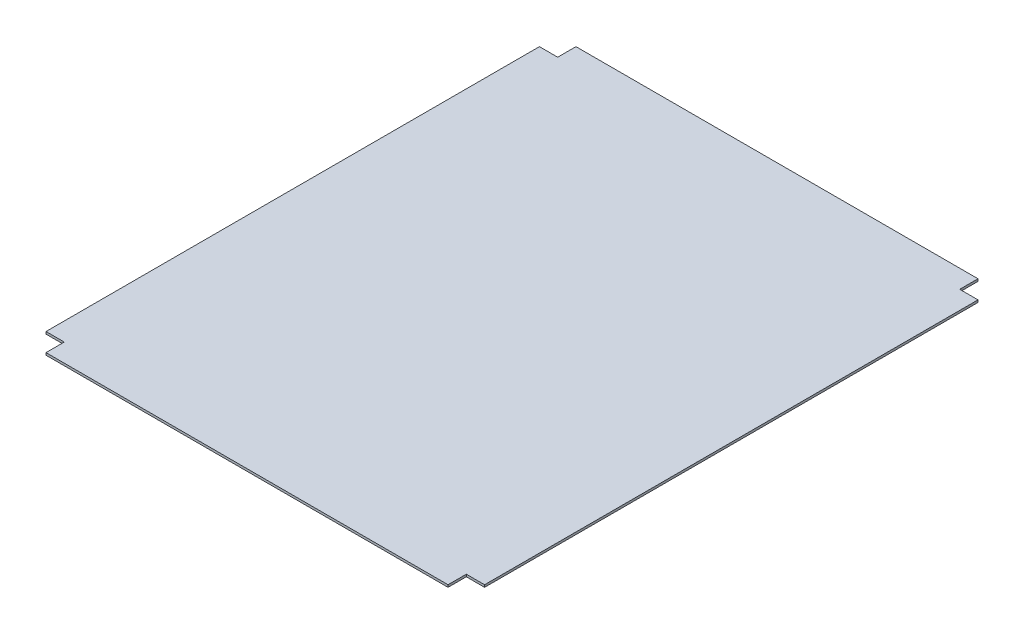
from build123d import *

# Parameters (mm, degrees)
SKETCH1_W           = 1219.2
SKETCH1_H           = 1473.2
BOSS_EXTRUDE1_DEPTH = 3.175
SKETCH2_W           = 50.8
SKETCH2_H           = 50.8
CUT_EXTRUDE1_DEPTH  = 957.154821407


with BuildPart() as part:
    # Sketch1 → Boss-Extrude1 (new, symmetric)
    with BuildSketch(Plane(origin=(0, 0, 0), x_dir=(1, 0, 0), z_dir=(0, 1, 0))):
        Rectangle(SKETCH1_W, SKETCH1_H)
    extrude(amount=BOSS_EXTRUDE1_DEPTH, both=True)

    # Sketch2 → Cut-Extrude1 (cut, through all)
    with BuildSketch(Plane(origin=(0, 3.175, 0), x_dir=(1, 0, 0), z_dir=(0, 1, 0))):
        with Locations((-584.2, 711.2)):
            Rectangle(SKETCH2_W, SKETCH2_H)
        with Locations((584.2, 711.2)):
            Rectangle(SKETCH2_W, SKETCH2_H)
        with Locations((584.2, -711.2)):
            Rectangle(SKETCH2_W, SKETCH2_H)
        with Locations((-584.2, -711.2)):
            Rectangle(SKETCH2_W, SKETCH2_H)
    extrude(amount=-CUT_EXTRUDE1_DEPTH, mode=Mode.SUBTRACT)


solid = part.part
